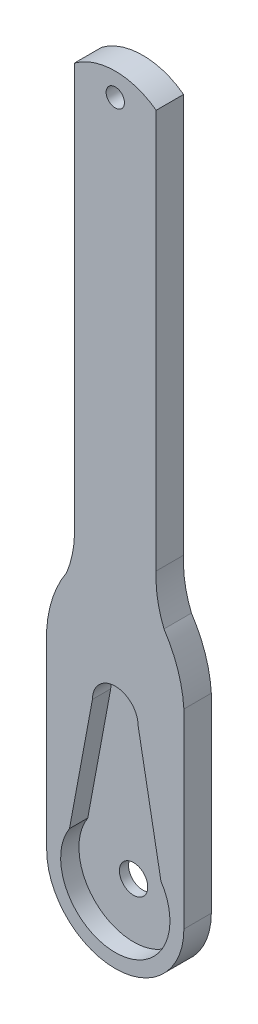
from build123d import *

# Parameters (mm, degrees)
BOSS_EXTRUDE1_DEPTH = 3
BOSS_EXTRUDE2_DEPTH = 1
SKETCH2_R           = 1
SKETCH2_R_2         = 1.55
CUT_EXTRUDE1_DEPTH  = 87.365502372


with BuildPart() as part:
    # Sketch1 → Boss-Extrude1 (new body)
    with BuildSketch(Plane.XY):
        with BuildLine():
            ThreePointArc((0, 7.5), (2.196699141, 2.196699141), (7.5, 0))
            ThreePointArc((7.5, 0), (12.803300859, 2.196699141), (15, 7.5))
            Line((15, 7.5), (15, 85))
            Line((15, 85), (0, 85))
            Line((0, 85), (0, 7.5))
        make_face()
        with BuildLine():
            Line((2.49254211, 10.759753131), (5, 24.25))
            ThreePointArc((5, 24.25), (7.5, 26.75), (10, 24.25))
            Line((10, 24.25), (12.49254211, 10.782552099))
            ThreePointArc((12.49254211, 10.782552099), (7.513622348, 1.525015529), (2.49254211, 10.759753131))
        make_face(mode=Mode.SUBTRACT)
    extrude(amount=BOSS_EXTRUDE1_DEPTH)

    # Sketch1<3> → Boss-Extrude2 (add)
    with BuildSketch(Plane.XY):
        with BuildLine():
            ThreePointArc((10, 24.25), (7.5, 26.75), (5, 24.25))
            Line((5, 24.25), (2.49254211, 10.759753131))
            ThreePointArc((2.49254211, 10.759753131), (7.513622348, 1.525015529), (12.49254211, 10.782552099))
            Line((12.49254211, 10.782552099), (10, 24.25))
        make_face()
    extrude(amount=BOSS_EXTRUDE2_DEPTH)

    # Sketch2 → Cut-Extrude1 (cut, through all)
    with BuildSketch(Plane.XY.offset(3)):
        with BuildLine():
            Line((15, 85), (7.5, 85))
            ThreePointArc((7.5, 85), (9.854016149, 84.620997681), (11.970118276, 83.522295459))
            Line((11.970118276, 83.522295459), (11.970118276, 39.891256895))
            ThreePointArc((11.970118276, 39.891256895), (12.117855654, 37.314502111), (12.826153951, 34.832606652))
            ThreePointArc((12.826153951, 34.832606652), (14.342347227, 31.727350556), (15, 28.334866171))
            Line((15, 28.334866171), (15, 85))
        make_face()
        with BuildLine():
            Line((7.5, 85), (0, 85))
            Line((0, 85), (0, 28.334866171))
            ThreePointArc((0, 28.334866171), (0.657652773, 31.727350556), (2.173846049, 34.832606652))
            ThreePointArc((2.173846049, 34.832606652), (2.882144346, 37.314502111), (3.029881724, 39.891256895))
            Line((3.029881724, 39.891256895), (3.029881724, 83.522295459))
            ThreePointArc((3.029881724, 83.522295459), (5.145983851, 84.620997681), (7.5, 85))
        make_face()
        with Locations((7.5, 82.5)):
            Circle(SKETCH2_R)
        with Locations((7.5, 7.5)):
            Circle(SKETCH2_R_2)
    extrude(amount=-CUT_EXTRUDE1_DEPTH, mode=Mode.SUBTRACT)


solid = part.part
